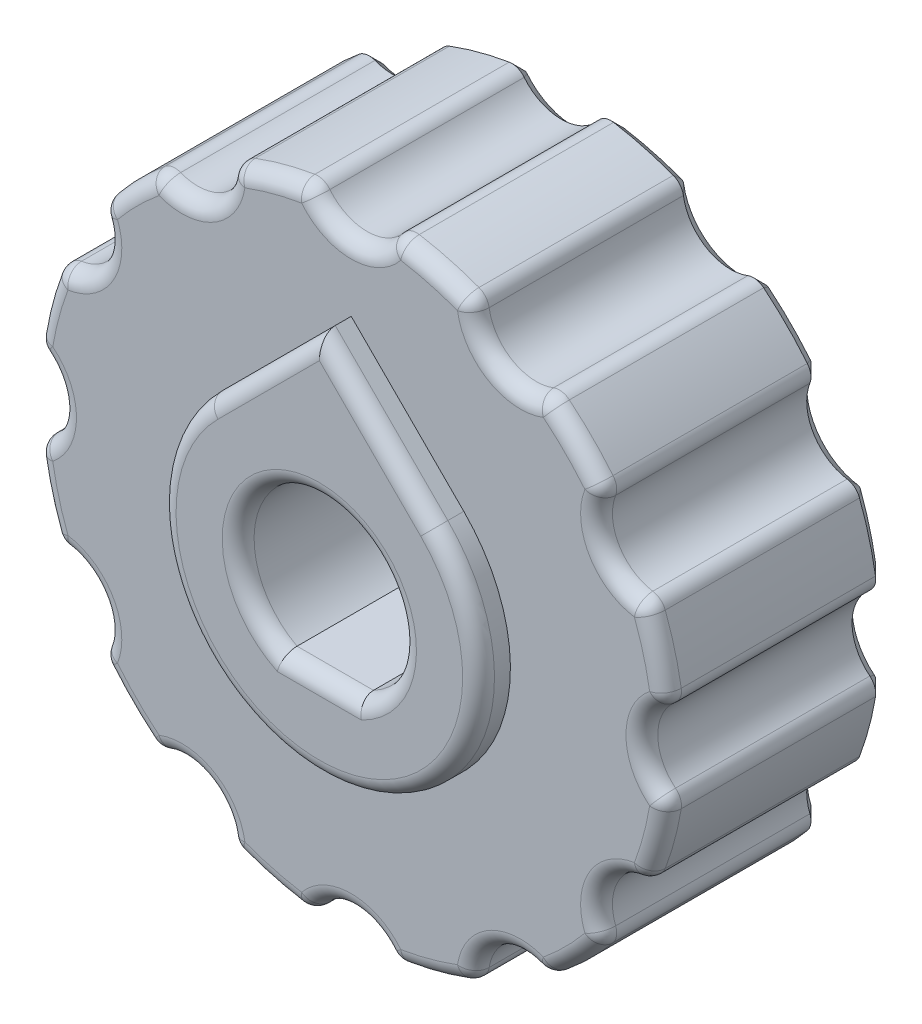
from build123d import *

# Parameters (mm, degrees)
SKETCH1_R                = 10
BOSS_EXTRUDE1_DEPTH      = 8
SKETCH2_R                = 1.5
CUT_EXTRUDE1_DEPTH       = 17.248076809
FILLET2_R                = 0.5
CIRPATTERN1_COUNT        = 12
FILLET2_OF_CIRPATTERN1_R = 0.5
SKETCH3_R                = 11.343148099
CUT_EXTRUDE2_DEPTH       = 1
FILLET1_R                = 0.5
CHAMFER1_SIZE            = 0.4
CHAMFER2_SIZE            = 0.6
CHAMFER2_SIZE2           = 2.239230485


with BuildPart() as part:
    # Sketch1 → Boss-Extrude1 (new body)
    with BuildSketch(Plane.XY):
        Circle(SKETCH1_R)
        with BuildLine():
            Line((1.2, -2.25), (-1.2, -2.25))
            ThreePointArc((-1.2, -2.25), (0, 2.55), (1.2, -2.25))
        make_face(mode=Mode.SUBTRACT)
    extrude(amount=BOSS_EXTRUDE1_DEPTH)

    # Sketch2 → Cut-Extrude1 (cut, through all)
    with BuildSketch(Plane.XY.offset(8)):
        with Locations((10.627307875, 0)):
            Circle(SKETCH2_R)
    cut_extrude1 = extrude(amount=-CUT_EXTRUDE1_DEPTH, mode=Mode.SUBTRACT)

    # Fillet2
    fillet2_edges = [part.edges().sort_by_distance(p)[0] for p in [
        (9.91265498, 1.318814331, 4),
        (9.91265498, -1.318814331, 4),
    ]]
    fillet(fillet2_edges, radius=FILLET2_R)

    # CirPattern1: Cut-Extrude1 ×12 about axis
    cirpattern1_axis = Axis((0, 0, 0), (0, 0, 1))
    for i in range(1, CIRPATTERN1_COUNT):
        add(cut_extrude1.rotate(cirpattern1_axis, i * 360 / CIRPATTERN1_COUNT), mode=Mode.SUBTRACT)

    # Fillet2 of CirPattern1
    fillet2_of_cirpattern1_edges = [part.edges().sort_by_distance(p)[0] for p in [
        (7.925203866, 6.098454204, 4),
        (9.244018197, 3.814200777, 4),
        (3.814200777, 9.244018197, 4),
        (6.098454204, 7.925203866, 4),
        (-1.318814331, 9.91265498, 4),
        (1.318814331, 9.91265498, 4),
        (-6.098454204, 7.925203866, 4),
        (-3.814200777, 9.244018197, 4),
        (-9.244018197, 3.814200777, 4),
        (-7.925203866, 6.098454204, 4),
        (-9.91265498, -1.318814331, 4),
        (-9.91265498, 1.318814331, 4),
        (-7.925203866, -6.098454204, 4),
        (-9.244018197, -3.814200777, 4),
        (-3.814200777, -9.244018197, 4),
        (-6.098454204, -7.925203866, 4),
        (1.318814331, -9.91265498, 4),
        (-1.318814331, -9.91265498, 4),
        (6.098454204, -7.925203866, 4),
        (3.814200777, -9.244018197, 4),
        (9.244018197, -3.814200777, 4),
        (7.925203866, -6.098454204, 4),
    ]]
    fillet(fillet2_of_cirpattern1_edges, radius=FILLET2_OF_CIRPATTERN1_R)

    # Sketch3 → Cut-Extrude2 (cut)
    with BuildSketch(Plane.XY.offset(8)):
        Circle(SKETCH3_R)
        with BuildLine():
            Line((0, 7.071067812), (-3.535533906, 3.535533906))
            ThreePointArc((-3.535533906, 3.535533906), (0, -5), (3.535533906, 3.535533906))
            Line((3.535533906, 3.535533906), (0, 7.071067812))
        make_face(mode=Mode.SUBTRACT)
    extrude(amount=-CUT_EXTRUDE2_DEPTH, mode=Mode.SUBTRACT)

    # Fillet1
    fillet1_edges = [part.edges().sort_by_distance(p)[0] for p in [
        (7.831332348, 6.113513595, 7),
        (-7.071067812, -7.071067812, 7),
        (-4.563653938, -7.904480488, 7),
        (-2.588190451, -9.659258263, 7),
        (0, -9.127307875, 7),
        (2.588190451, -9.659258263, 7),
        (4.563653938, -7.904480488, 7),
        (7.071067812, -7.071067812, 7),
        (7.904480488, -4.563653938, 7),
        (9.659258263, -2.588190451, 7),
        (9.127307875, 0, 7),
        (9.659258263, 2.588190451, 7),
        (7.904480488, 4.563653938, 7),
        (7.071067812, 7.071067812, 7),
        (4.563653938, 7.904480488, 7),
        (2.588190451, 9.659258263, 7),
        (0, 9.127307875, 7),
        (-2.588190451, 9.659258263, 7),
        (-4.563653938, 7.904480488, 7),
        (-7.071067812, 7.071067812, 7),
        (-7.904480488, 4.563653938, 7),
        (-9.659258263, 2.588190451, 7),
        (-9.127307875, 0, 7),
        (-9.659258263, -2.588190451, 7),
        (-7.904480488, -4.563653938, 7),
        (-7.831332348, -6.113513595, 7),
        (-9.210124254, -3.725375962, 7),
        (-9.838889557, -1.378791905, 7),
        (-9.838889557, 1.378791905, 7),
        (-9.210124254, 3.725375962, 7),
        (-7.831332348, 6.113513595, 7),
        (-6.113513595, 7.831332348, 7),
        (-3.725375962, 9.210124254, 7),
        (-1.378791905, 9.838889557, 7),
        (1.378791905, 9.838889557, 7),
        (3.725375962, 9.210124254, 7),
        (6.113513595, 7.831332348, 7),
        (9.210124254, 3.725375962, 7),
        (9.838889557, 1.378791905, 7),
        (9.838889557, -1.378791905, 7),
        (9.210124254, -3.725375962, 7),
        (7.831332348, -6.113513595, 7),
        (6.113513595, -7.831332348, 7),
        (3.725375962, -9.210124254, 7),
        (1.378791905, -9.838889557, 7),
        (-1.378791905, -9.838889557, 7),
        (-3.725375962, -9.210124254, 7),
        (-6.113513595, -7.831332348, 7),
        (1.767766953, 5.303300859, 8),
        (0, -5, 8),
        (-1.767766953, 5.303300859, 8),
        (0, 2.55, 8),
        (0, -2.25, 8),
    ]]
    fillet(fillet1_edges, radius=FILLET1_R - 0.0004)  # a hair under: the kernel refuses the full size

    # Chamfer1
    chamfer1_edges = [part.edges().sort_by_distance(p)[0] for p in [
        (7.904480488, -4.563653938, 0),
        (9.659258263, -2.588190451, 0),
        (9.210124254, -3.725375962, 0),
        (7.831332348, -6.113513595, 0),
        (4.563653938, -7.904480488, 0),
        (7.071067812, -7.071067812, 0),
        (6.113513595, -7.831332348, 0),
        (3.725375962, -9.210124254, 0),
        (0, -9.127307875, 0),
        (2.588190451, -9.659258263, 0),
        (1.378791905, -9.838889557, 0),
        (-1.378791905, -9.838889557, 0),
        (-4.563653938, -7.904480488, 0),
        (-2.588190451, -9.659258263, 0),
        (-3.725375962, -9.210124254, 0),
        (-6.113513595, -7.831332348, 0),
        (-7.904480488, -4.563653938, 0),
        (-7.071067812, -7.071067812, 0),
        (-7.831332348, -6.113513595, 0),
        (-9.210124254, -3.725375962, 0),
        (-9.127307875, 0, 0),
        (-9.659258263, -2.588190451, 0),
        (-9.838889557, -1.378791905, 0),
        (-9.838889557, 1.378791905, 0),
        (-7.904480488, 4.563653938, 0),
        (-9.659258263, 2.588190451, 0),
        (-9.210124254, 3.725375962, 0),
        (-7.831332348, 6.113513595, 0),
        (-4.563653938, 7.904480488, 0),
        (-7.071067812, 7.071067812, 0),
        (-6.113513595, 7.831332348, 0),
        (-3.725375962, 9.210124254, 0),
        (9.659258263, 2.588190451, 0),
        (0, 9.127307875, 0),
        (-2.588190451, 9.659258263, 0),
        (-1.378791905, 9.838889557, 0),
        (1.378791905, 9.838889557, 0),
        (4.563653938, 7.904480488, 0),
        (2.588190451, 9.659258263, 0),
        (3.725375962, 9.210124254, 0),
        (6.113513595, 7.831332348, 0),
        (7.904480488, 4.563653938, 0),
        (7.071067812, 7.071067812, 0),
        (7.831332348, 6.113513595, 0),
        (9.210124254, 3.725375962, 0),
        (9.127307875, 0, 0),
        (9.838889557, 1.378791905, 0),
        (9.838889557, -1.378791905, 0),
    ]]
    chamfer(chamfer1_edges, length=CHAMFER1_SIZE)

    # Chamfer2
    chamfer2_edges = [part.edges().sort_by_distance(p)[0] for p in [
        (0, 2.55, 0),
        (0, -2.25, 0),
    ]]
    chamfer2_side = [part.faces().sort_by_distance(p)[0] for p in [
        (7.326064571, -4.229705352, 0),
    ]]
    chamfer(chamfer2_edges, length=CHAMFER2_SIZE, length2=CHAMFER2_SIZE2, reference=chamfer2_side[0])


solid = part.part
